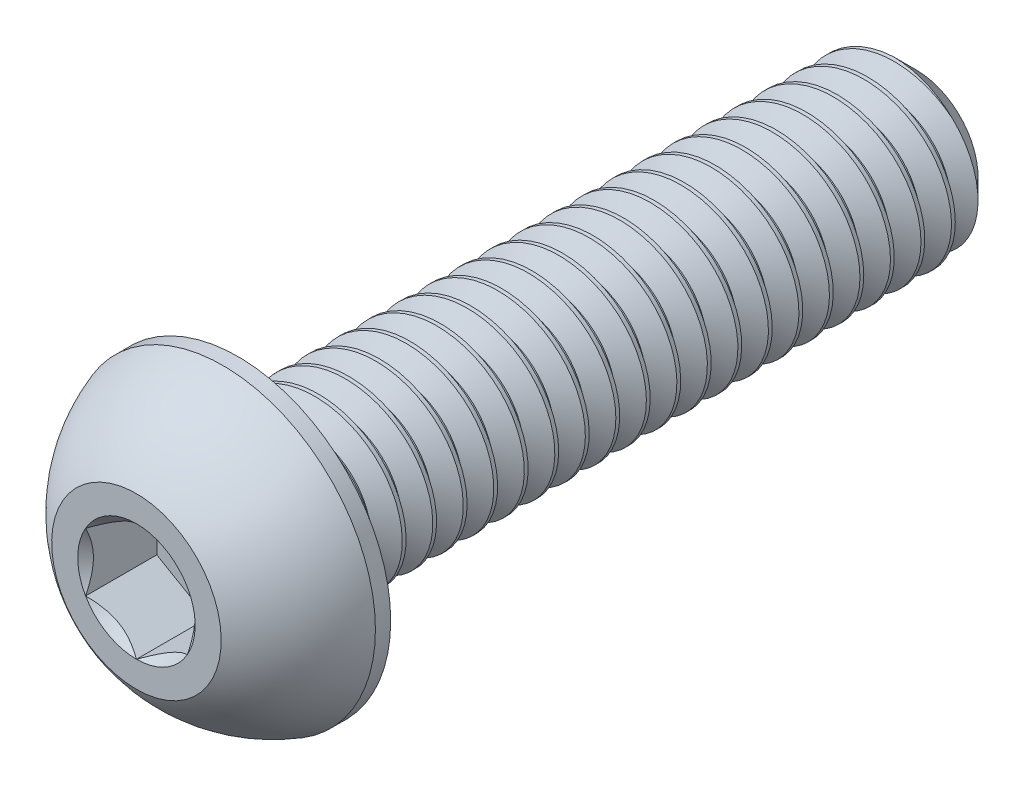
from build123d import *

# Parameters (mm, degrees)
SKETCH1_W          = 10
SKETCH1_H          = 1.25
CHAMFER1_SIZE      = 0.3375
CUT_EXTRUDE2_DEPTH = 1.05
CUT_SWEEP1_PITCH   = 0.45


with BuildPart() as part:
    # Sketch1 → Revolve1 (revolve)
    with BuildSketch(Plane(origin=(0, 0, 0), x_dir=(0, 0, -1), z_dir=(1, 0, 0))):
        with Locations((6.5, 0.625)):
            Rectangle(SKETCH1_W, SKETCH1_H)
    revolve(axis=Axis((0, 0, -11.5), (0, 0, 1)))

    # Chamfer1
    chamfer1_edges = [part.edges().sort_by_distance(p)[0] for p in [
        (0, -1.25, -11.5),
    ]]
    chamfer(chamfer1_edges, length=CHAMFER1_SIZE)

    # Sketch7 → Revolve2 (revolve)
    with BuildSketch(Plane(origin=(0, 0, 0), x_dir=(0, 0, -1), z_dir=(1, 0, 0)), mode=Mode.PRIVATE) as revolve2_sk:
        with BuildLine():
            Line((1.275, 2.25), (1.5, 2.25))
            Line((1.5, 2.25), (1.5, 0))
            Line((1.5, 0), (0, 0))
            Line((0, 0), (0, 1.25))
            ThreePointArc((0, 1.25), (0.549264706, 1.8625), (1.275, 2.25))
        make_face()
    revolve(revolve2_sk.sketch.rotate(Axis((0, 0, 0), (0, 0, -1)), 180), axis=Axis((0, 0, 0), (0, 0, -1)))

    # Sketch5 → Cut-Extrude2 (cut)
    with BuildSketch(Plane.XY):
        Polygon((0.75, -0.433012702), (0.75, 0.433012702), (0, 0.866025404), (-0.75, 0.433012702), (-0.75, -0.433012702), (0, -0.866025404), align=None)
    extrude(amount=-CUT_EXTRUDE2_DEPTH, mode=Mode.SUBTRACT)

    # Cut-Extrude3 cone 1 section (through the dimple's axis) → Cut-Extrude3 (revolve, cut)
    with BuildSketch(Plane(origin=(0, 0, 0), x_dir=(0, -1, 0), z_dir=(1, 0, 0))):
        Polygon((0, 0), (0.866025404, 0), (0, 0.866025404), align=None)
    revolve(axis=Axis((0, 0, 0), (0, 0, -1)), mode=Mode.SUBTRACT)

    # Cut-Sweep1: the profile of Sketch2 profile screwed along a right-hand helix of 23.222222 turns, 6 arcs to a turn; built about Z, then put on its axis
    cut_sweep1_z = Axis((0, 0, 0), (0, 0, 1))
    cut_sweep1_corners = [(1.2503, 0, 0.337673205), (1.2503, 0, -0.056423205), (0.957716426, 0, 0.1125), (0.957716426, 0, 0.16875)]
    with BuildLine(mode=Mode.PRIVATE) as cut_sweep1_profile:
        Line(cut_sweep1_corners[0], cut_sweep1_corners[1])
        Line(cut_sweep1_corners[1], cut_sweep1_corners[2])
        Line(cut_sweep1_corners[2], cut_sweep1_corners[3])
        Line(cut_sweep1_corners[3], cut_sweep1_corners[0])
    cut_sweep1_cap = Face(cut_sweep1_profile.wire())
    cut_sweep1_turn_angles = [0, 30, 60, 90, 120, 150, 180, 210, 240, 270, 300, 330, 360]
    cut_sweep1_turn_weights = [1, 0.8660254037844387, 1, 0.8660254037844387, 1, 0.8660254037844387, 1, 0.8660254037844387, 1, 0.8660254037844387, 1, 0.8660254037844387, 1]
    cut_sweep1_turn_rails = [Edge.make_bspline([Vector(p[0], p[1], 0).rotate(cut_sweep1_z, cut_sweep1_turn_angles[k]) / cut_sweep1_turn_weights[k] + Vector(0, 0, p[2] + CUT_SWEEP1_PITCH * cut_sweep1_turn_angles[k] / 360) for k in range(13)], [0, 0, 0, 1, 1, 2, 2, 3, 3, 4, 4, 5, 5, 6, 6, 6], 2, cut_sweep1_turn_weights) for p in cut_sweep1_corners]
    cut_sweep1_turn_sides = [Face.make_surface_from_curves(cut_sweep1_turn_rails[p[0]], cut_sweep1_turn_rails[p[1]]) for p in [(0, 1), (1, 2), (2, 3), (3, 0)]]
    cut_sweep1_last_angles = [8280, 8310, 8340, 8350, 8360]
    cut_sweep1_last_weights = [1, 0.8660254037844387, 1, 0.9848077530121557, 1]
    cut_sweep1_last_rails = [Edge.make_bspline([Vector(p[0], p[1], 0).rotate(cut_sweep1_z, cut_sweep1_last_angles[k]) / cut_sweep1_last_weights[k] + Vector(0, 0, p[2] + CUT_SWEEP1_PITCH * cut_sweep1_last_angles[k] / 360) for k in range(5)], [0, 0, 0, 1, 1, 2, 2, 2], 2, cut_sweep1_last_weights) for p in cut_sweep1_corners]
    cut_sweep1_last_sides = [Face.make_surface_from_curves(cut_sweep1_last_rails[p[0]], cut_sweep1_last_rails[p[1]]) for p in [(0, 1), (1, 2), (2, 3), (3, 0)]]
    cut_sweep1 = Plane(origin=(0, 0, -11.5), x_dir=(0, 1, 0), z_dir=(0, 0, 1)) * Solid(Shell([*[p.moved(Location((0, 0, CUT_SWEEP1_PITCH * i))) for i in range(23) for p in cut_sweep1_turn_sides], *cut_sweep1_last_sides, cut_sweep1_cap, cut_sweep1_cap.rotate(cut_sweep1_z, 8360).moved(Location((0, 0, CUT_SWEEP1_PITCH * 8360 / 360)))]))
    add(cut_sweep1, mode=Mode.SUBTRACT)


solid = part.part
